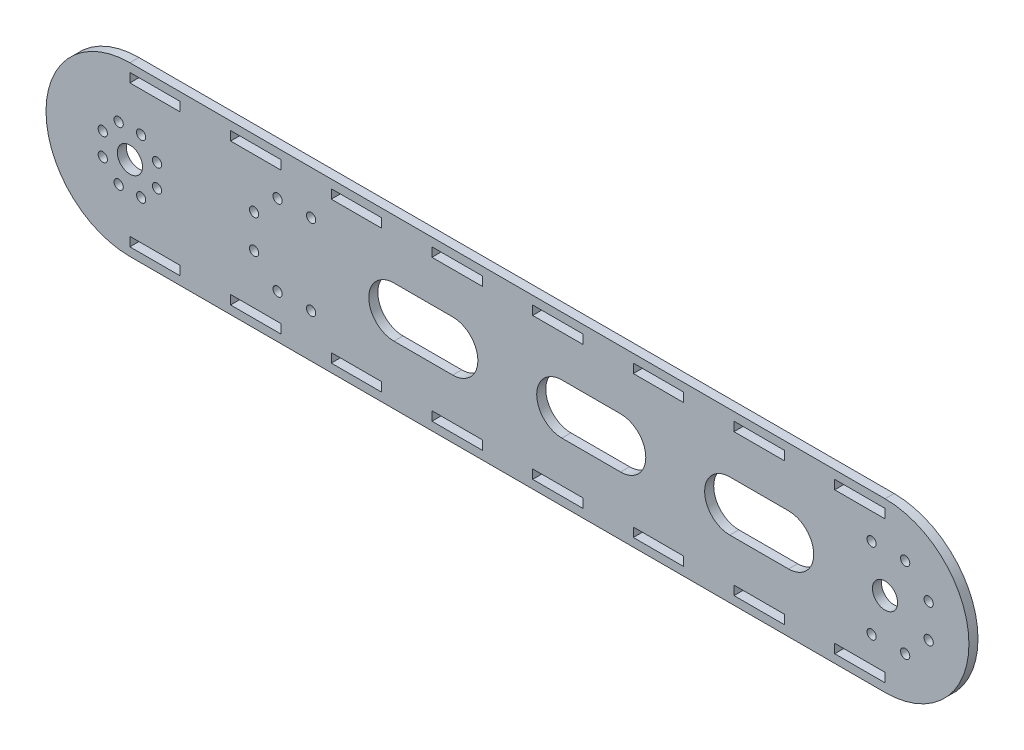
from build123d import *

# Parameters (mm, degrees)
SKETCH3_W           = 30
SKETCH3_H           = 5.4
SKETCH3_R           = 2.75
SKETCH3_R_2         = 7.5
BOSS_EXTRUDE1_DEPTH = 5.4


with BuildPart() as part:
    # Sketch3 → Boss-Extrude1 (new body)
    with BuildSketch(Plane.XY):
        with BuildLine():
            Line((207.5, 50), (-242.5, 50))
            ThreePointArc((-242.5, 50), (-292.5, 0), (-242.5, -50))
            Line((-242.5, -50), (207.5, -50))
            ThreePointArc((207.5, -50), (257.5, 0), (207.5, 50))
        make_face()
        with Locations((-227.5, -42.3)):
            Rectangle(SKETCH3_W, SKETCH3_H, mode=Mode.SUBTRACT)
        with Locations((-167.5, -42.3)):
            Rectangle(SKETCH3_W, SKETCH3_H, mode=Mode.SUBTRACT)
        with Locations((-107.5, -42.3)):
            Rectangle(SKETCH3_W, SKETCH3_H, mode=Mode.SUBTRACT)
        with Locations((-47.5, -42.3)):
            Rectangle(SKETCH3_W, SKETCH3_H, mode=Mode.SUBTRACT)
        with Locations((-249.196960066, -16.167891819)):
            Circle(SKETCH3_R, mode=Mode.SUBTRACT)
        with Locations((-235.803039934, -16.167891819)):
            Circle(SKETCH3_R, mode=Mode.SUBTRACT)
        with Locations((-258.667891819, -6.696960066)):
            Circle(SKETCH3_R, mode=Mode.SUBTRACT)
        with Locations((-226.332108181, -6.696960066)):
            Circle(SKETCH3_R, mode=Mode.SUBTRACT)
        with BuildLine():
            ThreePointArc((-235, 0), (-249.855889603, -1.463177415), (-235.570903506, 2.870125743))
            ThreePointArc((-235.570903506, 2.870125743), (-235.144110397, 1.463177415), (-235, 0))
        make_face(mode=Mode.SUBTRACT)
        with Locations((-168.5, -10)):
            Circle(SKETCH3_R, mode=Mode.SUBTRACT)
        with Locations((-154.5, -24)):
            Circle(SKETCH3_R, mode=Mode.SUBTRACT)
        with Locations((-134.5, -24)):
            Circle(SKETCH3_R, mode=Mode.SUBTRACT)
        with BuildLine():
            ThreePointArc((-85.152, -15), (-100.152, 0), (-85.152, 15))
            Line((-85.152, 15), (-50.152, 15))
            ThreePointArc((-50.152, 15), (-35.152, 0), (-50.152, -15))
            Line((-50.152, -15), (-85.152, -15))
        make_face(mode=Mode.SUBTRACT)
        with Locations((12.5, -42.3)):
            Rectangle(SKETCH3_W, SKETCH3_H, mode=Mode.SUBTRACT)
        with Locations((72.5, -42.3)):
            Rectangle(SKETCH3_W, SKETCH3_H, mode=Mode.SUBTRACT)
        with Locations((132.5, -42.3)):
            Rectangle(SKETCH3_W, SKETCH3_H, mode=Mode.SUBTRACT)
        with Locations((192.5, -42.3)):
            Rectangle(SKETCH3_W, SKETCH3_H, mode=Mode.SUBTRACT)
        with BuildLine():
            ThreePointArc((14.924, -15), (-0.076, 0), (14.924, 15))
            Line((14.924, 15), (49.924, 15))
            ThreePointArc((49.924, 15), (64.924, 0), (49.924, -15))
            Line((49.924, -15), (14.924, -15))
        make_face(mode=Mode.SUBTRACT)
        with Locations((199.5, -24)):
            Circle(SKETCH3_R, mode=Mode.SUBTRACT)
        with Locations((219.5, -24)):
            Circle(SKETCH3_R, mode=Mode.SUBTRACT)
        with BuildLine():
            ThreePointArc((115, -15), (100, 0), (115, 15))
            Line((115, 15), (150, 15))
            ThreePointArc((150, 15), (165, 0), (150, -15))
            Line((150, -15), (115, -15))
        make_face(mode=Mode.SUBTRACT)
        with Locations((233.5, -10)):
            Circle(SKETCH3_R, mode=Mode.SUBTRACT)
        with Locations((207.5, 0)):
            Circle(SKETCH3_R_2, mode=Mode.SUBTRACT)
        with Locations((-258.667891819, 6.696960066)):
            Circle(SKETCH3_R, mode=Mode.SUBTRACT)
        with BuildLine():
            ThreePointArc((-223.582108181, 6.696960066), (-225.795609796, 3.999800545), (-228.872776895, 5.644580627))
            ThreePointArc((-228.872776895, 5.644580627), (-226.868606567, 9.394119587), (-223.582108181, 6.696960066))
        make_face(mode=Mode.SUBTRACT)
        with Locations((-168.5, 10)):
            Circle(SKETCH3_R, mode=Mode.SUBTRACT)
        with Locations((-249.196960066, 16.167891819)):
            Circle(SKETCH3_R, mode=Mode.SUBTRACT)
        with Locations((-235.803039934, 16.167891819)):
            Circle(SKETCH3_R, mode=Mode.SUBTRACT)
        with Locations((-154.5, 24)):
            Circle(SKETCH3_R, mode=Mode.SUBTRACT)
        with Locations((-134.5, 24)):
            Circle(SKETCH3_R, mode=Mode.SUBTRACT)
        with Locations((-227.5, 42.3)):
            Rectangle(SKETCH3_W, SKETCH3_H, mode=Mode.SUBTRACT)
        with Locations((-167.5, 42.3)):
            Rectangle(SKETCH3_W, SKETCH3_H, mode=Mode.SUBTRACT)
        with Locations((-107.5, 42.3)):
            Rectangle(SKETCH3_W, SKETCH3_H, mode=Mode.SUBTRACT)
        with Locations((-47.5, 42.3)):
            Rectangle(SKETCH3_W, SKETCH3_H, mode=Mode.SUBTRACT)
        with Locations((233.5, 10)):
            Circle(SKETCH3_R, mode=Mode.SUBTRACT)
        with Locations((199.5, 24)):
            Circle(SKETCH3_R, mode=Mode.SUBTRACT)
        with Locations((219.5, 24)):
            Circle(SKETCH3_R, mode=Mode.SUBTRACT)
        with Locations((12.5, 42.3)):
            Rectangle(SKETCH3_W, SKETCH3_H, mode=Mode.SUBTRACT)
        with Locations((72.5, 42.3)):
            Rectangle(SKETCH3_W, SKETCH3_H, mode=Mode.SUBTRACT)
        with Locations((132.5, 42.3)):
            Rectangle(SKETCH3_W, SKETCH3_H, mode=Mode.SUBTRACT)
        with Locations((192.5, 42.3)):
            Rectangle(SKETCH3_W, SKETCH3_H, mode=Mode.SUBTRACT)
    extrude(amount=BOSS_EXTRUDE1_DEPTH)


solid = part.part
